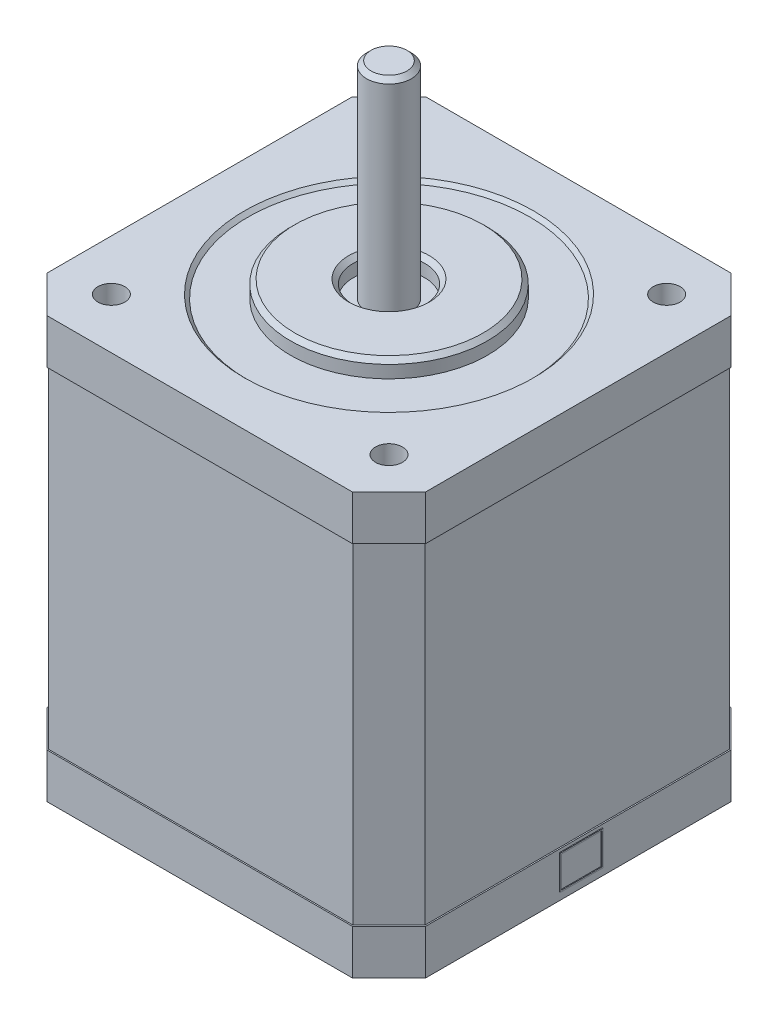
from build123d import *

# Parameters (mm, degrees)
SKETCH1_W           = 42
SKETCH1_H           = 42
BOSS_EXTRUDE1_DEPTH = 47
CHAMFER1_SIZE       = 4
BOSS_EXTRUDE4_DEPTH = 5
BOSS_EXTRUDE5_DEPTH = 5
SKETCH2_R           = 16.25
CUT_EXTRUDE1_DEPTH  = 0.4
SKETCH3_R           = 11
SKETCH3_R_2         = 4
BOSS_EXTRUDE2_DEPTH = 1.9
SKETCH4_R           = 2.5
BOSS_EXTRUDE3_DEPTH = 23
CHAMFER2_SIZE       = 0.5
SKETCH5_R           = 1.5
CUT_EXTRUDE2_DEPTH  = 5
SKETCH8_W           = 4.8
SKETCH8_H           = 3.8
SKETCH8_W_2         = 4.5
SKETCH8_H_2         = 3.5
BOSS_EXTRUDE6_DEPTH = 0.1


with BuildPart() as part:
    # Sketch1 → Boss-Extrude1 (new body)
    with BuildSketch(Plane(origin=(0, 0, 0), x_dir=(1, 0, 0), z_dir=(0, 1, 0))):
        Rectangle(SKETCH1_W, SKETCH1_H)
    extrude(amount=BOSS_EXTRUDE1_DEPTH)

    # Chamfer1
    chamfer1_edges = [part.edges().sort_by_distance(p)[0] for p in [
        (21, 23.5, 21),
        (-21, 23.5, 21),
        (-21, 23.5, -21),
        (21, 23.5, -21),
    ]]
    chamfer(chamfer1_edges, length=CHAMFER1_SIZE)

    # Sketch6 → Boss-Extrude4 (add)
    with BuildSketch(Plane(origin=(0, 47, 0), x_dir=(1, 0, 0), z_dir=(0, 1, 0))):
        Polygon((17.062132034, 21.15), (-17.062132034, 21.15), (-21.15, 17.062132034), (-21.15, -17.062132034), (-17.062132034, -21.15), (17.062132034, -21.15), (21.15, -17.062132034), (21.15, 17.062132034), align=None)
    extrude(amount=-BOSS_EXTRUDE4_DEPTH)

    # Sketch7 → Boss-Extrude5 (add)
    with BuildSketch(Plane.XZ):
        Polygon((-21.15, 17.062132034), (-21.15, -17.062132034), (-17.062132034, -21.15), (17.062132034, -21.15), (21.15, -17.062132034), (21.15, 17.062132034), (17.062132034, 21.15), (-17.062132034, 21.15), align=None)
    extrude(amount=-BOSS_EXTRUDE5_DEPTH)

    # Sketch2 → Cut-Extrude1 (cut)
    with BuildSketch(Plane(origin=(0, 47, 0), x_dir=(1, 0, 0), z_dir=(0, 1, 0))):
        with Locations(Location((0, 0, 0), (0, 0, 270))):
            Circle(SKETCH2_R)
    extrude(amount=-CUT_EXTRUDE1_DEPTH, mode=Mode.SUBTRACT)

    # Sketch3 → Boss-Extrude2 (add)
    with BuildSketch(Plane(origin=(0, 46.6, 0), x_dir=(1, 0, 0), z_dir=(0, 1, 0))):
        with Locations(Location((0, 0, 0), (0, 0, 90))):
            Circle(SKETCH3_R)
        with Locations(Location((0, 0, 0), (0, 0, 90))):
            Circle(SKETCH3_R_2, mode=Mode.SUBTRACT)
    extrude(amount=BOSS_EXTRUDE2_DEPTH)

    # Sketch4 → Boss-Extrude3 (add)
    with BuildSketch(Plane(origin=(0, 46.6, 0), x_dir=(1, 0, 0), z_dir=(0, 1, 0))):
        with Locations(Location((0, 0, 0), (0, 0, 270))):
            Circle(SKETCH4_R)
    extrude(amount=BOSS_EXTRUDE3_DEPTH)

    # Chamfer2
    # the kernel refuses this chamfer: 0.5 mm, written as the material it adds along each edge
    with BuildSketch(Plane(origin=(0, 46.6, 0), x_dir=(0, 0, 1), z_dir=(-1, 0, 0))) as chamfer2_piece_1_section:
        Polygon((16.25, CHAMFER2_SIZE), (16.25 - CHAMFER2_SIZE, 0), (16.25, 0), align=None)
    chamfer2_piece_1 = revolve(axis=Axis((0, 46.6, 0), (0, 1, 0)), mode=Mode.PRIVATE)
    chamfer2_piece_1 = split(chamfer2_piece_1, bisect_by=Plane(origin=(0, 47, -15.959627936), z_dir=(0, -1, 0)), keep=Keep.TOP, mode=Mode.PRIVATE)
    add(chamfer2_piece_1)
    # the kernel refuses this chamfer: 0.5 mm, written as the material it takes off along each edge
    with BuildSketch(Plane(origin=(0, 48.5, 0), x_dir=(0, 0, -1), z_dir=(1, 0, 0))) as chamfer2_2_piece_1:
        Polygon((4 + CHAMFER2_SIZE, 0), (4, -CHAMFER2_SIZE), (4, 0), align=None)
    revolve(axis=Axis((0, 48.5, 0), (0, 1, 0)), mode=Mode.SUBTRACT)
    with BuildSketch(Plane(origin=(0, 48.5, 0), x_dir=(0, 0, -1), z_dir=(1, 0, 0))) as chamfer2_2_piece_2:
        Polygon((11, -CHAMFER2_SIZE), (11 - CHAMFER2_SIZE, 0), (11, 0), align=None)
    revolve(axis=Axis((0, 48.5, 0), (0, 1, 0)), mode=Mode.SUBTRACT)
    with BuildSketch(Plane(origin=(0, 69.6, 0), x_dir=(0, 0, 1), z_dir=(-1, 0, 0))) as chamfer2_2_piece_3:
        Polygon((2.5, -CHAMFER2_SIZE), (2.5 - CHAMFER2_SIZE, 0), (2.5, 0), align=None)
    revolve(axis=Axis((0, 69.6, 0), (0, 1, 0)), mode=Mode.SUBTRACT)

    # Sketch5 → Cut-Extrude2 (cut)
    with BuildSketch(Plane(origin=(0, 47, 0), x_dir=(1, 0, 0), z_dir=(0, 1, 0))):
        with Locations(Location((-15.5, 15.5, 0), (0, 0, 270))):
            Circle(SKETCH5_R)
        with Locations(Location((15.5, 15.5, 0), (0, 0, 270))):
            Circle(SKETCH5_R)
        with Locations(Location((15.5, -15.5, 0), (0, 0, 270))):
            Circle(SKETCH5_R)
        with Locations(Location((-15.5, -15.5, 0), (0, 0, 270))):
            Circle(SKETCH5_R)
    extrude(amount=-CUT_EXTRUDE2_DEPTH, mode=Mode.SUBTRACT)

    # Sketch8 → Boss-Extrude6 (add)
    with BuildSketch(Plane(origin=(21.15, 0, 0), x_dir=(0, 0, -1), z_dir=(1, 0, 0))):
        with Locations((0.269797982, 2.75)):
            Rectangle(SKETCH8_W, SKETCH8_H)
        with Locations((0.269797982, 2.75)):
            Rectangle(SKETCH8_W_2, SKETCH8_H_2, mode=Mode.SUBTRACT)
    extrude(amount=BOSS_EXTRUDE6_DEPTH)


solid = part.part
